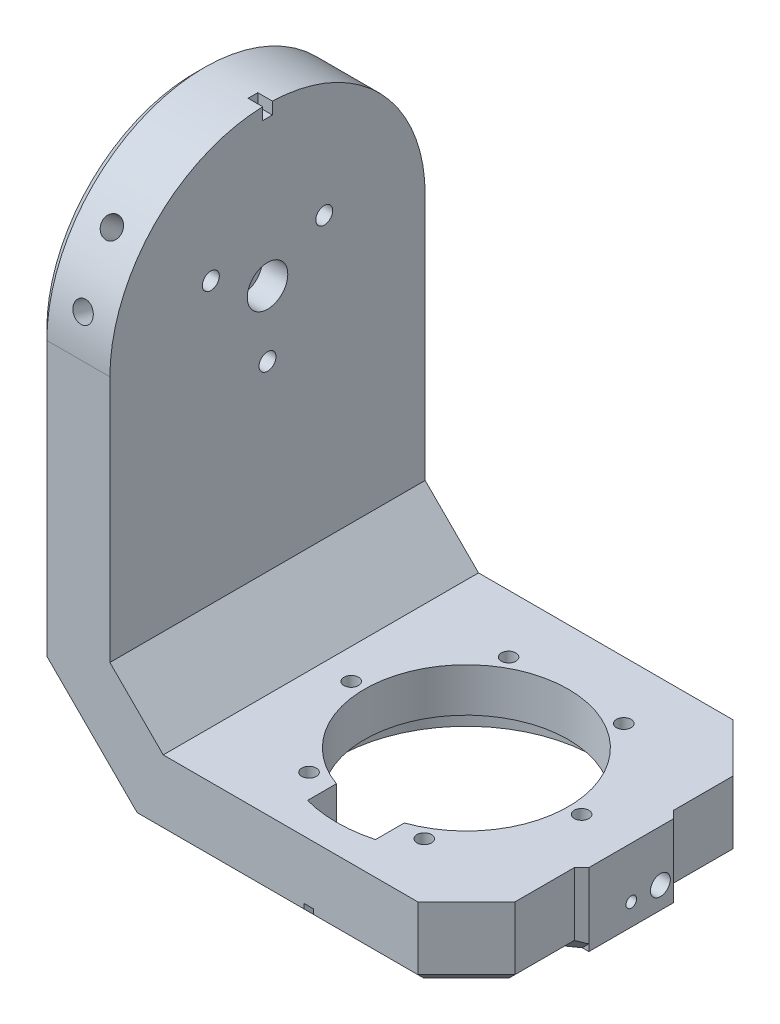
from build123d import *

# Parameters (mm, degrees)
EXTRUDE_1_DEPTH          = 32.5
SKETCH_2_R               = 1.75
CUT_EXTRUDE_1_DEPTH      = 122.727153914
SKETCH_3_R               = 26.675
CUT_EXTRUDE_2_DEPTH      = 6
CUT_EXTRUDE_3_REACH      = 133.037
SKETCH_4_R               = 1.5
SKETCH_4_R_2             = 21
SKETCH_5_R               = 4.175
CUT_EXTRUDE_4_DEPTH      = 5.2
CHAMFER_1_SIZE           = 10
CUT_EXTRUDE_START        = -9
CUT_EXTRUDE_5_DEPTH      = 9
SKETCH_7_R               = 3.25
CUT_EXTRUDE_6_DEPTH      = 3
CHAMFER_2_SIZE           = 2
PATTERN_CIRCULAR_1_COUNT = 2
PATTERN_CIRCULAR_1_ANGLE = 24
SKETCH_10_W              = 2
SKETCH_10_H              = 3
CUT_EXTRUDE_7_DEPTH      = 3
SKETCH_11_W              = 3.5
SKETCH_11_H              = 17.5
EXTRUDE_2_DEPTH          = 15
CHAMFER_3_SIZE           = 1.5
SKETCH_12_R              = 1.1
CUT_EXTRUDE_8_DEPTH      = 3
SKETCH_13_R              = 2.05
CUT_EXTRUDE_9_DEPTH      = 6.5
SKETCH_14_W              = 2
SKETCH_14_H              = 3
CUT_EXTRUDE_10_DEPTH     = 3


with BuildPart() as part:
    # Эскиз1 → Бобышка-Вытянуть1 (new, symmetric)
    with BuildSketch(Plane.XY):
        Polygon((0, 40), (0, -51), (11, -62), (73.5, -62), (73.5, -77), (4.786796564, -77), (-15, -57.213203436), (-15, 40), align=None)
    extrude(amount=EXTRUDE_1_DEPTH, both=True)

    # Эскиз2 → Вырез-Вытянуть1 (cut, through all)
    with BuildSketch(Plane.ZY.offset(15)):
        with BuildLine():
            Line((32.5, 0), (32.5, 40))
            Line((32.5, 40), (-32.5, 40))
            Line((-32.5, 40), (-32.5, 0))
            ThreePointArc((-32.5, 0), (0, 32.5), (32.5, 0))
        make_face()
        with Locations(Location((0, -13.5, 0), (0, 0, 270))):
            Circle(SKETCH_2_R)
        with Locations(Location((11.691342951, 6.75, 0), (0, 0, 270))):
            Circle(SKETCH_2_R)
        with Locations(Location((-11.691342951, 6.75, 0), (0, 0, 270))):
            Circle(SKETCH_2_R)
    extrude(amount=-CUT_EXTRUDE_1_DEPTH, mode=Mode.SUBTRACT)

    # Эскиз3 → Вырез-Вытянуть2 (cut)
    with BuildSketch(Plane.XZ.offset(77)):
        with Locations((41, 0)):
            Circle(SKETCH_3_R)
    extrude(amount=-CUT_EXTRUDE_2_DEPTH, mode=Mode.SUBTRACT)

    # Эскиз4 → Вырез-Вытянуть3 (cut, up to next)
    with BuildSketch(Plane.XZ.offset(71), mode=Mode.PRIVATE) as cut_extrude_3_sk1:
        with Locations((64.75, 0)):
            Circle(SKETCH_4_R)
    cut_extrude_3_tool1 = extrude(cut_extrude_3_sk1.sketch, amount=-CUT_EXTRUDE_3_REACH, mode=Mode.PRIVATE) & part.part
    # Эскиз4 → Вырез-Вытянуть3 (cut, up to next)
    with BuildSketch(Plane.XZ.offset(71), mode=Mode.PRIVATE) as cut_extrude_3_sk2:
        with Locations((52.875, -20.56810334)):
            Circle(SKETCH_4_R)
    cut_extrude_3_tool2 = extrude(cut_extrude_3_sk2.sketch, amount=-CUT_EXTRUDE_3_REACH, mode=Mode.PRIVATE) & part.part
    # Эскиз4 → Вырез-Вытянуть3 (cut, up to next)
    with BuildSketch(Plane.XZ.offset(71), mode=Mode.PRIVATE) as cut_extrude_3_sk3:
        with Locations((29.125, -20.56810334)):
            Circle(SKETCH_4_R)
    cut_extrude_3_tool3 = extrude(cut_extrude_3_sk3.sketch, amount=-CUT_EXTRUDE_3_REACH, mode=Mode.PRIVATE) & part.part
    # Эскиз4 → Вырез-Вытянуть3 (cut, up to next)
    with BuildSketch(Plane.XZ.offset(71), mode=Mode.PRIVATE) as cut_extrude_3_sk4:
        with Locations((17.25, 0)):
            Circle(SKETCH_4_R)
    cut_extrude_3_tool4 = extrude(cut_extrude_3_sk4.sketch, amount=-CUT_EXTRUDE_3_REACH, mode=Mode.PRIVATE) & part.part
    # Эскиз4 → Вырез-Вытянуть3 (cut, up to next)
    with BuildSketch(Plane.XZ.offset(71), mode=Mode.PRIVATE) as cut_extrude_3_sk5:
        with Locations((29.125, 20.56810334)):
            Circle(SKETCH_4_R)
    cut_extrude_3_tool5 = extrude(cut_extrude_3_sk5.sketch, amount=-CUT_EXTRUDE_3_REACH, mode=Mode.PRIVATE) & part.part
    # Эскиз4 → Вырез-Вытянуть3 (cut, up to next)
    with BuildSketch(Plane.XZ.offset(71), mode=Mode.PRIVATE) as cut_extrude_3_sk6:
        with Locations((52.875, 20.56810334)):
            Circle(SKETCH_4_R)
    cut_extrude_3_tool6 = extrude(cut_extrude_3_sk6.sketch, amount=-CUT_EXTRUDE_3_REACH, mode=Mode.PRIVATE) & part.part
    # Эскиз4 → Вырез-Вытянуть3 (cut, up to next)
    with BuildSketch(Plane.XZ.offset(71), mode=Mode.PRIVATE) as cut_extrude_3_sk7:
        with Locations((41, 0)):
            Circle(SKETCH_4_R_2)
    cut_extrude_3_tool7 = extrude(cut_extrude_3_sk7.sketch, amount=-CUT_EXTRUDE_3_REACH, mode=Mode.PRIVATE) & part.part
    add(cut_extrude_3_tool1.solids().sort_by_distance((64.75, -71, 0))[0], mode=Mode.SUBTRACT)
    add(cut_extrude_3_tool2.solids().sort_by_distance((52.875, -71, -20.568103))[0], mode=Mode.SUBTRACT)
    add(cut_extrude_3_tool3.solids().sort_by_distance((29.125, -71, -20.568103))[0], mode=Mode.SUBTRACT)
    add(cut_extrude_3_tool4.solids().sort_by_distance((17.25, -71, 0))[0], mode=Mode.SUBTRACT)
    add(cut_extrude_3_tool5.solids().sort_by_distance((29.125, -71, 20.568103))[0], mode=Mode.SUBTRACT)
    add(cut_extrude_3_tool6.solids().sort_by_distance((52.875, -71, 20.568103))[0], mode=Mode.SUBTRACT)
    add(cut_extrude_3_tool7.solids().sort_by_distance((41, -71, 0))[0], mode=Mode.SUBTRACT)

    # Эскиз5 → Вырез-Вытянуть4 (cut)
    with BuildSketch(Plane(origin=(0, 0, 0), x_dir=(0, 0, -1), z_dir=(1, 0, 0))):
        with Locations(Location((0, 0, 0), (0, 0, 90))):
            Circle(SKETCH_5_R)
    extrude(amount=-CUT_EXTRUDE_4_DEPTH, mode=Mode.SUBTRACT)

    # Фаска1
    chamfer_1_edges = [part.edges().sort_by_distance(p)[0] for p in [
        (73.5, -69.5, 32.5),
        (73.5, -69.5, -32.5),
    ]]
    chamfer(chamfer_1_edges, length=CHAMFER_1_SIZE)

    # Эскиз6 → Вырез-Вытянуть5 (cut)
    with BuildSketch(Plane.XZ.offset(71).offset(CUT_EXTRUDE_START)):
        with BuildLine():
            ThreePointArc((34, 19.798989873), (41, 21), (48, 19.798989873))
            Line((48, 19.798989873), (48, 25.740155885))
            ThreePointArc((48, 25.740155885), (41, 26.675), (34, 25.740155885))
            Line((34, 25.740155885), (34, 19.798989873))
        make_face()
    extrude(amount=CUT_EXTRUDE_5_DEPTH, mode=Mode.SUBTRACT)

    # Эскиз7 → Вырез-Вытянуть6 (cut)
    with BuildSketch(Plane.ZY.offset(15)):
        with Locations(Location((11.691342951, 6.75, 0), (0, 0, 270))):
            Circle(SKETCH_7_R)
        with Locations(Location((0, -13.5, 0), (0, 0, 270))):
            Circle(SKETCH_7_R)
        with Locations(Location((-11.691342951, 6.75, 0), (0, 0, 270))):
            Circle(SKETCH_7_R)
    extrude(amount=-CUT_EXTRUDE_6_DEPTH, mode=Mode.SUBTRACT)

    # Фаска2
    chamfer_2_edges = [part.edges().sort_by_distance(p)[0] for p in [
        (73.5, -77, 0),
        (34.143398282, -77, -32.5),
        (68.5, -77, 27.5),
        (68.5, -77, -27.5),
        (-5.106601718, -67.106601718, -32.5),
        (-5.106601718, -67.106601718, 32.5),
        (34.143398282, -77, 32.5),
        (-15, -28.606601718, -32.5),
        (-15, -28.606601718, 32.5),
        (-15, 32.5, 0),
    ]]
    chamfer(chamfer_2_edges, length=CHAMFER_2_SIZE)

    # Эскиз9 → Вырез-Повернуть1 (revolve, cut)
    with BuildSketch(Plane(origin=(-6.5, 0, 0), x_dir=(0, 0, -1), z_dir=(1, 0, 0))):
        Polygon((-19.70026884, 15.391536883), (-18.438162816, 17.006958928), (-24.742248845, 21.932250731), (-26.004354869, 20.316828686), align=None)
    cut_revolve_1 = revolve(axis=Axis((-6.5, 0, 0), (0, 0.6156614753256564, 0.7880107536067235)), mode=Mode.SUBTRACT)

    # Круговой массив1: Вырез-Повернуть1 ×2 about axis
    pattern_circular_1_axis = Axis((73.5, 0, 0), (1, 0, 0))
    for i in range(1, PATTERN_CIRCULAR_1_COUNT):
        add(cut_revolve_1.rotate(pattern_circular_1_axis, i * PATTERN_CIRCULAR_1_ANGLE / (PATTERN_CIRCULAR_1_COUNT - 1)), mode=Mode.SUBTRACT)

    # Эскиз10 → Вырез-Вытянуть7 (cut)
    with BuildSketch(Plane(origin=(0, 0, 0), x_dir=(0, 0, -1), z_dir=(1, 0, 0))):
        with Locations((0, 31.5)):
            Rectangle(SKETCH_10_W, SKETCH_10_H)
    extrude(amount=-CUT_EXTRUDE_7_DEPTH, mode=Mode.SUBTRACT)

    # Эскиз11 → Бобышка-Вытянуть2 (add)
    with BuildSketch(Plane.XZ.offset(77)):
        with Locations((73.25, 0)):
            Rectangle(SKETCH_11_W, SKETCH_11_H)
    extrude(amount=-EXTRUDE_2_DEPTH)

    # Фаска3
    chamfer_3_edges = [part.edges().sort_by_distance(p)[0] for p in [
        (72.5, -76, -8.75),
        (73.5, -68.5, -8.75),
        (72.5, -76, 8.75),
        (73.5, -68.5, 8.75),
    ]]
    chamfer(chamfer_3_edges, length=CHAMFER_3_SIZE - 0.0001)  # a hair under: the kernel refuses the full size

    # Эскиз12 → Вырез-Вытянуть8 (cut)
    with BuildSketch(Plane(origin=(75, 0, 0), x_dir=(0, 0, -1), z_dir=(1, 0, 0))):
        with Locations(Location((0, -72.5, 0), (0, 0, 90))):
            Circle(SKETCH_12_R)
    extrude(amount=-CUT_EXTRUDE_8_DEPTH, mode=Mode.SUBTRACT)

    # Эскиз13 → Вырез-Вытянуть9 (cut)
    with BuildSketch(Plane(origin=(75, 0, 0), x_dir=(0, 0, -1), z_dir=(1, 0, 0))):
        with Locations(Location((6, -72.5, 0), (0, 0, 90))):
            Circle(SKETCH_13_R)
    extrude(amount=-CUT_EXTRUDE_9_DEPTH, mode=Mode.SUBTRACT)

    # Эскиз14 → Вырез-Вытянуть10 (cut)
    with BuildSketch(Plane.XZ.offset(77)):
        with Locations((41, 31)):
            Rectangle(SKETCH_14_W, SKETCH_14_H)
    extrude(amount=-CUT_EXTRUDE_10_DEPTH, mode=Mode.SUBTRACT)


solid = part.part
